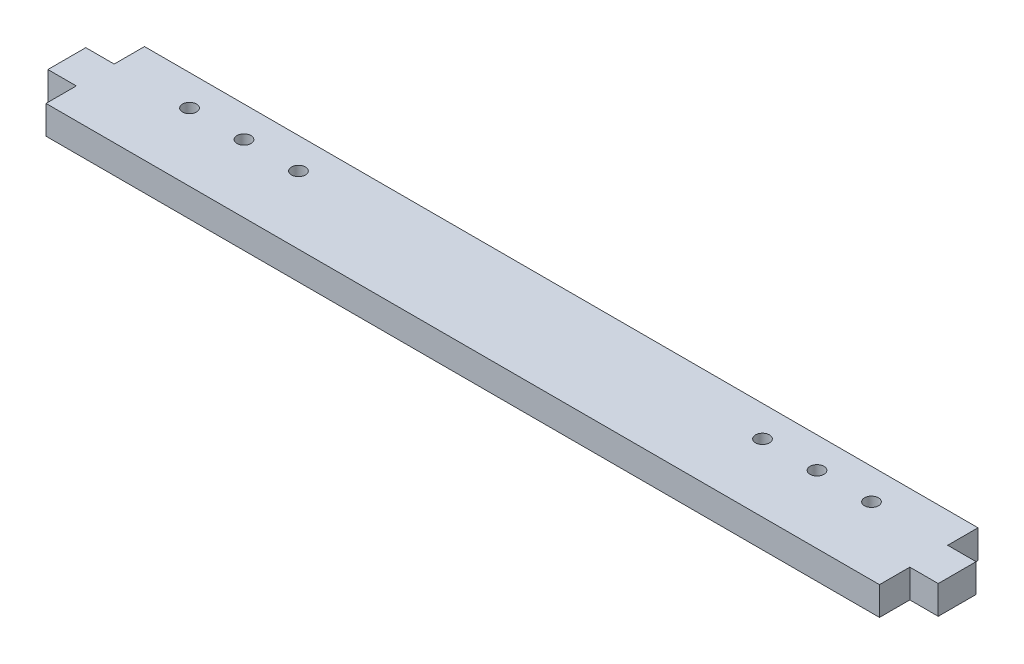
from build123d import *

# Parameters (mm, degrees)
SKETCH1_W           = 279.4
SKETCH1_H           = 33.02
BOSS_EXTRUDE1_DEPTH = 9.525
SKETCH2_W           = 12.7
SKETCH2_H           = 9.525
BOSS_EXTRUDE2_DEPTH = 9.525
SKETCH3_R           = 2.3368
CUT_EXTRUDE1_DEPTH  = 151.437383486


with BuildPart() as part:
    # Sketch1 → Boss-Extrude1 (new body)
    with BuildSketch(Plane(origin=(0, 0, 0), x_dir=(1, 0, 0), z_dir=(0, 1, 0))):
        Rectangle(SKETCH1_W, SKETCH1_H)
    extrude(amount=BOSS_EXTRUDE1_DEPTH)

    # Sketch2 → Boss-Extrude2 (add)
    with BuildSketch(Plane(origin=(139.7, 0, 0), x_dir=(0, 0, -1), z_dir=(1, 0, 0))):
        with Locations((0, 4.7625)):
            Rectangle(SKETCH2_W, SKETCH2_H)
    boss_extrude2 = extrude(amount=BOSS_EXTRUDE2_DEPTH)

    # Mirror1: Boss-Extrude2 across plane
    add(boss_extrude2.mirror(Plane(origin=(0, 0, 0), x_dir=(0, 0, 1), z_dir=(1, 0, 0))))

    # Sketch3 → Cut-Extrude1 (cut, through all)
    with BuildSketch(Plane.XZ):
        with Locations((114.3, -6.1976)):
            Circle(SKETCH3_R)
        with Locations((77.7748, -6.1976)):
            Circle(SKETCH3_R)
        with Locations((96.0374, -6.1976)):
            Circle(SKETCH3_R)
    cut_extrude1 = extrude(amount=-CUT_EXTRUDE1_DEPTH, mode=Mode.SUBTRACT)

    # Mirror2: Cut-Extrude1 across plane
    add(cut_extrude1.mirror(Plane(origin=(0, 0, 0), x_dir=(0, 0, 1), z_dir=(1, 0, 0))), mode=Mode.SUBTRACT)


solid = part.part
